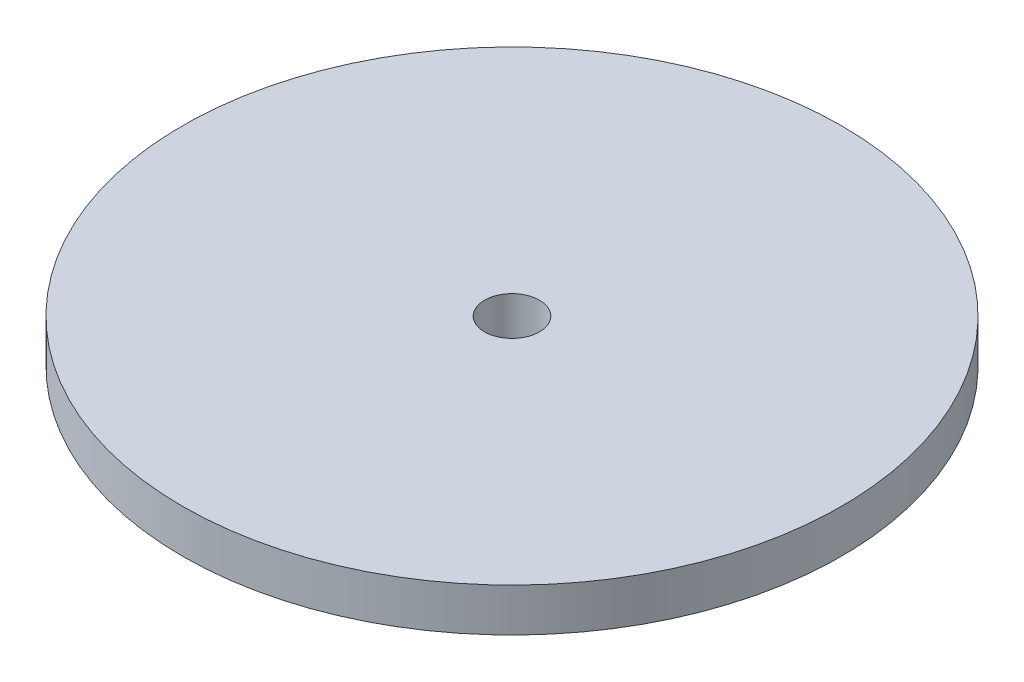
from build123d import *

# Parameters (mm, degrees)
SKETCH2_R               = 76.1746
BOSS_EXTRUDE1_DEPTH     = 10
CUT_EXTRUDE1_DEPTH      = 109.190292403
CUT_EXTRUDE1_DEPTH_BACK = 109.190292403
SKETCH3_R               = 6.35


with BuildPart() as part:
    # Sketch2 → Boss-Extrude1 (new body)
    with BuildSketch(Plane(origin=(0, 0, 0), x_dir=(1, 0, 0), z_dir=(0, 1, 0))):
        Circle(SKETCH2_R)
    extrude(amount=BOSS_EXTRUDE1_DEPTH)

    # Sketch3 → Cut-Extrude1 (cut, two sides: drawn at the far end of the back side and taken through both)
    with BuildSketch(Plane(origin=(0, 10, 0), x_dir=(1, 0, 0), z_dir=(0, 1, 0)).offset(-CUT_EXTRUDE1_DEPTH_BACK)):
        Circle(SKETCH3_R)
    extrude(amount=CUT_EXTRUDE1_DEPTH + CUT_EXTRUDE1_DEPTH_BACK, mode=Mode.SUBTRACT)


solid = part.part
